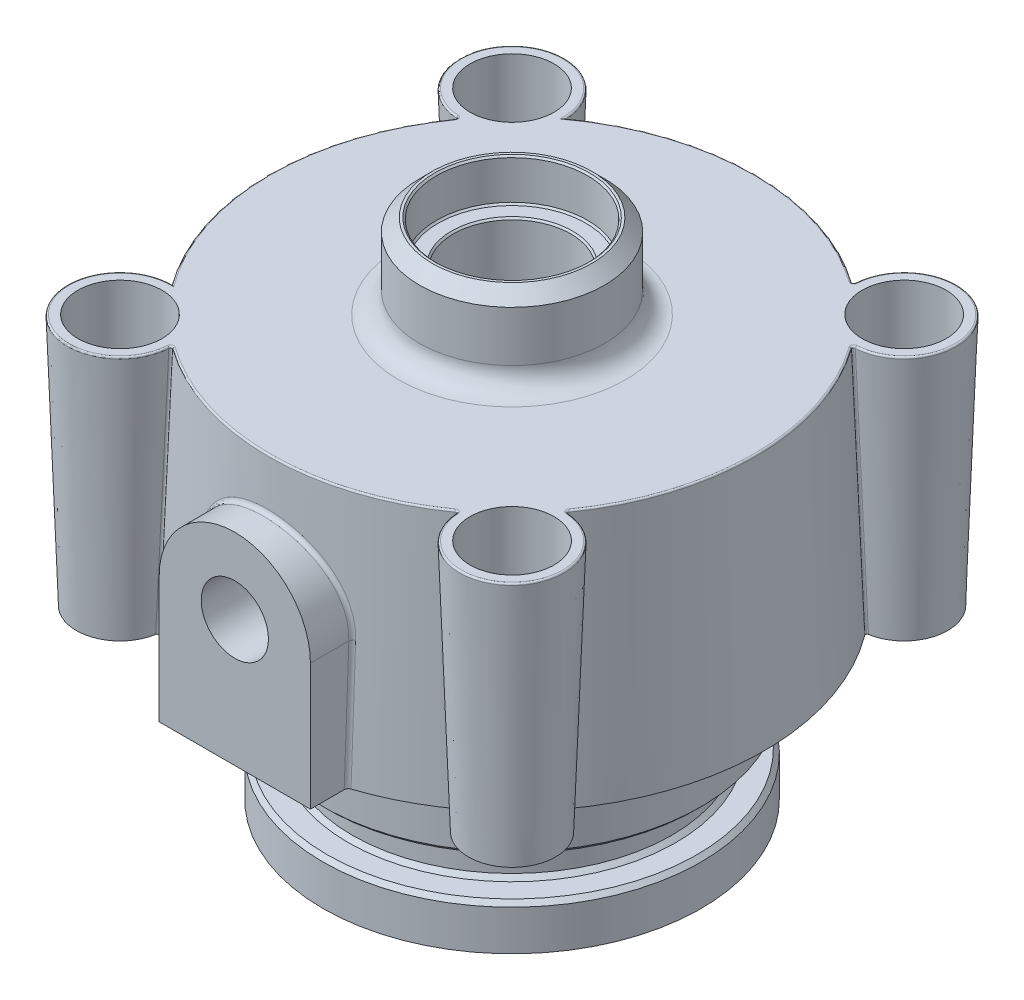
from build123d import *
from build123d.topology import SkipClean

# Parameters (mm, degrees)
SKETCH1_R                = 22.5
BOSS_EXTRUDE1_DEPTH      = 20
SKETCH2_R                = 30
BOSS_EXTRUDE2_DEPTH      = 30
BOSS_EXTRUDE2_TAPER      = 2
SKETCH3_R                = 11
BOSS_EXTRUDE3_DEPTH      = 10
CROQUIS1_R               = 7
CORTAR_EXTRUIR1_DEPTH    = 90
CROQUIS2_R               = 9
CORTAR_EXTRUIR2_DEPTH    = 5
CROQUIS3_R               = 6.234995269
SALIENTE_EXTRUIR1_DEPTH  = 30
SALIENTE_EXTRUIR1_DRAFT  = -2
MATRIZC1_COPY_1_SKETCH_R = 6.234995269
MATRIZC1_COPY_1_DEPTH    = 30
MATRIZC1_COPY_1_DRAFT    = -2
MATRIZC1_COPY_2_SKETCH_R = 6.234995269
MATRIZC1_COPY_2_DEPTH    = 30
MATRIZC1_COPY_2_DRAFT    = -2
MATRIZC1_COPY_3_SKETCH_R = 6.234995269
MATRIZC1_COPY_3_DEPTH    = 30
MATRIZC1_COPY_3_DRAFT    = -2
SKETCH8_R                = 4
SALIENTE_EXTRUIR2_DEPTH  = 10
MATRIZC2_COUNT           = 2
CROQUIS11_R              = 4
CORTAR_EXTRUIR5_DEPTH    = 40
CROQUIS12_W              = 3.5
CROQUIS12_H              = 4.7
CROQUIS13_W              = 11.998294714
CROQUIS13_H              = 4.103281459
SKETCH8_4_R              = 4
CORTAR_EXTRUIR7_DEPTH    = 7
CORTAR_EXTRUIR8_START    = -0.2
SKETCH8_5_R              = 4
CORTAR_EXTRUIR8_DEPTH    = 0.2
CROQUIS16_R              = 3
CORTAR_EXTRUIR9_DEPTH    = 34
CROQUIS17_R              = 3.5
CORTAR_EXTRUIR10_DEPTH   = 8
CORTAR_EXTRUIR11_START   = -0.2
CROQUIS17_2_R            = 3.5
CORTAR_EXTRUIR11_DEPTH   = 0.2
CROQUIS18_R              = 3
CORTAR_EXTRUIR12_DEPTH   = 8
CROQUIS19_R              = 2.5
CORTAR_EXTRUIR13_DEPTH   = 20
CROQUIS21_R              = 5
CROQUIS21_R_2            = 2.5
CORTAR_EXTRUIR14_DEPTH   = 10
MATRIZC3_COUNT           = 4
REDONDEO8_R              = 0.2
CHAFL_N1_SIZE            = 0.25
REDONDEO10_R             = 2.5
CROQUIS24_R              = 3
CORTAR_EXTRUIR16_DEPTH   = 30
CROQUIS25_R              = 3
CORTAR_EXTRUIR17_DEPTH   = 30
CHAFL_N2_SIZE            = 1.5
CHAFL_N3_SIZE            = 0.5
REDONDEO11_R             = 0.5
CHAFL_N4_SIZE            = 0.2
CHAFL_N5_SIZE            = 0.2
CHAFL_N6_SIZE            = 0.2
CHAFL_N7_SIZE            = 0.5
REDONDEO13_R             = 0.5
REDONDEO14_R             = 0.5


with BuildPart() as part:
    # Sketch1 → Boss-Extrude1 (new body)
    with BuildSketch(Plane(origin=(0, 0, 0), x_dir=(1, 0, 0), z_dir=(0, 1, 0))):
        with Locations(Location((0, 0, 0), (0, 0, 270))):
            Circle(SKETCH1_R)
    extrude(amount=BOSS_EXTRUDE1_DEPTH)

    # Sketch2 → Boss-Extrude2 (add)
    with BuildSketch(Plane(origin=(0, 20, 0), x_dir=(1, 0, 0), z_dir=(0, 1, 0))):
        Circle(SKETCH2_R)
    extrude(amount=BOSS_EXTRUDE2_DEPTH, taper=BOSS_EXTRUDE2_TAPER)

    # Sketch3 → Boss-Extrude3 (add)
    with BuildSketch(Plane(origin=(0, 50, 0), x_dir=(1, 0, 0), z_dir=(0, 1, 0))):
        with Locations(Location((0, 0, 0), (0, 0, 270))):
            Circle(SKETCH3_R)
    extrude(amount=BOSS_EXTRUDE3_DEPTH)

    # Croquis1 → Cortar-Extruir1 (cut)
    with BuildSketch(Plane(origin=(0, 60, 0), x_dir=(1, 0, 0), z_dir=(0, 1, 0))):
        with Locations(Location((0, 0, 0), (0, 0, 270))):
            Circle(CROQUIS1_R)
    extrude(amount=-CORTAR_EXTRUIR1_DEPTH, mode=Mode.SUBTRACT)

    # Croquis2 → Cortar-Extruir2 (cut)
    with BuildSketch(Plane(origin=(0, 60, 0), x_dir=(1, 0, 0), z_dir=(0, 1, 0))):
        with Locations(Location((0, 0, 0), (0, 0, 270))):
            Circle(CROQUIS2_R)
    extrude(amount=-CORTAR_EXTRUIR2_DEPTH, mode=Mode.SUBTRACT)


with BuildPart() as saliente_extruir1_tool:
    # Croquis3 → Saliente-Extruir1 (with draft: the straight prism first)
    with BuildSketch(Plane(origin=(0, 50, 0), x_dir=(1, 0, 0), z_dir=(0, 1, 0))):
        with Locations((-23.334523779, 23.334523779)):
            Circle(CROQUIS3_R)
    extrude(amount=-SALIENTE_EXTRUIR1_DEPTH)
    # Saliente-Extruir1: the draft: its side faces are tilted about the plane it starts from
    saliente_extruir1_sides = [saliente_extruir1_tool.faces().sort_by_distance(p)[0] for p in [
        (-29.569519048, 35, -23.334523779),
    ]]
    draft(saliente_extruir1_sides, Plane(origin=(0, 50, 0), x_dir=(1, 0, 0), z_dir=(0, 1, 0)), SALIENTE_EXTRUIR1_DRAFT)


with BuildPart() as part_1:
    add(part.part)

    # Saliente-Extruir1: add saliente_extruir1_tool
    add(saliente_extruir1_tool.part)


with BuildPart() as matrizc1_copy_1_tool:
    # MatrizC1 copy 1 sketch → MatrizC1 copy 1 (with draft: the straight prism first)
    with BuildSketch(Plane(origin=(0, 50, 0), x_dir=(0, 0, -1), z_dir=(0, 1, 0))):
        with Locations((-23.334523779, 23.334523779)):
            Circle(MATRIZC1_COPY_1_SKETCH_R)
    extrude(amount=-MATRIZC1_COPY_1_DEPTH)
    # MatrizC1 copy 1: the draft: its side faces are tilted about the plane it starts from
    matrizc1_copy_1_sides = [matrizc1_copy_1_tool.faces().sort_by_distance(p)[0] for p in [
        (-23.334523779, 35, 29.569519048),
    ]]
    draft(matrizc1_copy_1_sides, Plane(origin=(0, 50, 0), x_dir=(0, 0, -1), z_dir=(0, 1, 0)), MATRIZC1_COPY_1_DRAFT)


with BuildPart() as part_2:
    add(part_1.part)

    # MatrizC1 copy 1: add matrizc1_copy_1_tool
    add(matrizc1_copy_1_tool.part)


with BuildPart() as matrizc1_copy_2_tool:
    # MatrizC1 copy 2 sketch → MatrizC1 copy 2 (with draft: the straight prism first)
    with BuildSketch(Plane(origin=(0, 50, 0), x_dir=(-1, 0, 0), z_dir=(0, 1, 0))):
        with Locations((-23.334523779, 23.334523779)):
            Circle(MATRIZC1_COPY_2_SKETCH_R)
    extrude(amount=-MATRIZC1_COPY_2_DEPTH)
    # MatrizC1 copy 2: the draft: its side faces are tilted about the plane it starts from
    matrizc1_copy_2_sides = [matrizc1_copy_2_tool.faces().sort_by_distance(p)[0] for p in [
        (29.569519048, 35, 23.334523779),
    ]]
    draft(matrizc1_copy_2_sides, Plane(origin=(0, 50, 0), x_dir=(-1, 0, 0), z_dir=(0, 1, 0)), MATRIZC1_COPY_2_DRAFT)


with BuildPart() as part_3:
    add(part_2.part)

    # MatrizC1 copy 2: add matrizc1_copy_2_tool
    add(matrizc1_copy_2_tool.part)


with BuildPart() as matrizc1_copy_3_tool:
    # MatrizC1 copy 3 sketch → MatrizC1 copy 3 (with draft: the straight prism first)
    with BuildSketch(Plane.ZX.offset(50)):
        with Locations((-23.334523779, 23.334523779)):
            Circle(MATRIZC1_COPY_3_SKETCH_R)
    extrude(amount=-MATRIZC1_COPY_3_DEPTH)
    # MatrizC1 copy 3: the draft: its side faces are tilted about the plane it starts from
    matrizc1_copy_3_sides = [matrizc1_copy_3_tool.faces().sort_by_distance(p)[0] for p in [
        (23.334523779, 35, -29.569519048),
    ]]
    draft(matrizc1_copy_3_sides, Plane.ZX.offset(50), MATRIZC1_COPY_3_DRAFT)


with BuildPart() as part_4:
    add(part_3.part)

    # MatrizC1 copy 3: add matrizc1_copy_3_tool
    add(matrizc1_copy_3_tool.part)

    # Sketch8 → Saliente-Extruir2 (add)
    with BuildSketch(Plane.XY.offset(23)):
        with BuildLine():
            Line((-9, 20), (-9, 35.048848589))
            ThreePointArc((-9, 35.048848589), (0, 44.048848589), (9, 35.048848589))
            Line((9, 35.048848589), (9, 20))
            Line((9, 20), (-9, 20))
        make_face()
        with Locations(Location((0, 35.048848589, 0), (0, 0, 224.629878984))):
            Circle(SKETCH8_R, mode=Mode.SUBTRACT)
    saliente_extruir2 = extrude(amount=SALIENTE_EXTRUIR2_DEPTH)

    # MatrizC2: Saliente-Extruir2 ×2 about axis
    matrizc2_axis = Axis((0, 0, 0), (0, 1, 0))
    for i in range(1, MATRIZC2_COUNT):
        add(saliente_extruir2.rotate(matrizc2_axis, i * 360 / MATRIZC2_COUNT))

    # Croquis11 → Cortar-Extruir5 (cut)
    with SkipClean():  # the faces are left unmerged after this step: merging them gives an invalid solid
        with BuildSketch(Plane(origin=(0, 0, -37), x_dir=(-1, 0, 0), z_dir=(0, 0, -1))):
            with Locations(Location((0, 35.048848589, 0), (0, 0, 315.370121016))):
                Circle(CROQUIS11_R)
        extrude(amount=-CORTAR_EXTRUIR5_DEPTH, mode=Mode.SUBTRACT)
    add(part_4.part.scale(1), mode=Mode.REPLACE)  # the faces are merged on a copy

    # Croquis12 → Cortar-Revolución1 (revolve, cut)
    with BuildSketch(Plane(origin=(0, 0, 0), x_dir=(0, 0, -1), z_dir=(1, 0, 0)), mode=Mode.PRIVATE) as cortar_revoluci_n1_sk:
        with Locations((-20.75, 7.65)):
            Rectangle(CROQUIS12_W, CROQUIS12_H)
    revolve(cortar_revoluci_n1_sk.sketch.rotate(Axis((0, 0, 0), (0, 1, 0)), 180), axis=Axis((0, 0, 0), (0, 1, 0)), mode=Mode.SUBTRACT)

    # Croquis13 → Cortar-Revolución3 (revolve, cut)
    with BuildSketch(Plane(origin=(0, 0, 0), x_dir=(0, 0, -1), z_dir=(1, 0, 0))):
        with Locations((-5.999147357, 15.802504601)):
            Rectangle(CROQUIS13_W, CROQUIS13_H)
    revolve(axis=Axis((0, 17.85414533, -0.001705286), (0, -1, 0)), mode=Mode.SUBTRACT)

    # Sketch8<4> → Cortar-Extruir7 (cut)
    with BuildSketch(Plane.XY.offset(23)):
        with Locations((0, 35.048848589)):
            Circle(SKETCH8_4_R)
    extrude(amount=CORTAR_EXTRUIR7_DEPTH, mode=Mode.SUBTRACT)

    # Sketch8<5> → Cortar-Extruir8 (cut)
    with BuildSketch(Plane.XY.offset(23).offset(CORTAR_EXTRUIR8_START)):
        with Locations((0, 35.048848589)):
            Circle(SKETCH8_5_R)
    extrude(amount=CORTAR_EXTRUIR8_DEPTH, mode=Mode.SUBTRACT)

    # Croquis16 → Cortar-Extruir9 (cut)
    with BuildSketch(Plane.XZ):
        with Locations(Location((0, 14.310353932, 0), (0, 0, 270))):
            Circle(CROQUIS16_R)
    extrude(amount=-CORTAR_EXTRUIR9_DEPTH, mode=Mode.SUBTRACT)

    # Croquis17 → Cortar-Extruir10 (cut)
    with BuildSketch(Plane.XY.offset(15)):
        with Locations(Location((0, 35.048848589, 0), (0, 0, 213.468692257))):
            Circle(CROQUIS17_R)
    extrude(amount=CORTAR_EXTRUIR10_DEPTH, mode=Mode.SUBTRACT)

    # Croquis17<2> → Cortar-Extruir11 (cut)
    with BuildSketch(Plane.XY.offset(15).offset(CORTAR_EXTRUIR11_START)):
        with Locations(Location((0, 35.048848589, 0), (0, 0, 212.258465463))):
            Circle(CROQUIS17_2_R)
    extrude(amount=CORTAR_EXTRUIR11_DEPTH, mode=Mode.SUBTRACT)

    # Croquis18 → Cortar-Extruir12 (cut)
    with BuildSketch(Plane.XY.offset(13)):
        with Locations((0, 35.048848589)):
            Circle(CROQUIS18_R)
    extrude(amount=CORTAR_EXTRUIR12_DEPTH, mode=Mode.SUBTRACT)

    # Croquis19 → Cortar-Extruir13 (cut)
    with BuildSketch(Plane.XY):
        with Locations(Location((0, 35.048848589, 0), (0, 0, 269.999999999))):
            Circle(CROQUIS19_R)
    extrude(amount=CORTAR_EXTRUIR13_DEPTH, mode=Mode.SUBTRACT)

    # Croquis21 → Cortar-Extruir14 (cut)
    # profile 1 of 2: a face of its own
    with BuildSketch(Plane(origin=(0, 50, 0), x_dir=(1, 0, 0), z_dir=(0, 1, 0))):
        with Locations(Location((-23.334523779, 23.334523779, 0), (0, 0, 270))):
            Circle(CROQUIS21_R)
        with Locations((-23.334523779, 23.334523779)):
            Circle(CROQUIS21_R_2, mode=Mode.SUBTRACT)
    # profile 2 of 2: a face of its own
    with BuildSketch(Plane(origin=(0, 50, 0), x_dir=(1, 0, 0), z_dir=(0, 1, 0))):
        with Locations((-23.334523779, 23.334523779)):
            Circle(CROQUIS21_R_2)
    cortar_extruir14 = extrude(amount=-CORTAR_EXTRUIR14_DEPTH, mode=Mode.SUBTRACT)

    # MatrizC3: Cortar-Extruir14 ×4 about axis
    matrizc3_axis = Axis((0, 0, 0), (0, 1, 0))
    for i in range(1, MATRIZC3_COUNT):
        add(cortar_extruir14.rotate(matrizc3_axis, i * 360 / MATRIZC3_COUNT), mode=Mode.SUBTRACT)

    # Redondeo8
    redondeo8_edges = [part_4.edges().sort_by_distance(p)[0] for p in [
        (-23.628212149, 34.642434193, -17.643399327),
        (-17.643399327, 34.642434193, 23.628212149),
        (23.628212149, 34.642434193, 17.643399327),
        (17.643399327, 34.642434193, 23.628212149),
        (17.643399327, 34.642434193, -23.628212149),
        (23.628212149, 34.642434193, -17.643399327),
    ]]
    fillet(redondeo8_edges, radius=REDONDEO8_R)
    redondeo8_2_edges = [part_4.edges().sort_by_distance(p)[0] for p in [
        (-28.951772779, 50, 0.18703477),
        (-27.610766074, 50, -27.872025056),
        (0, 50, 28.952376915),
        (28.952376915, 50, 0),
        (-0.18703477, 50, -28.951772779),
        (-27.872025056, 50, 27.610766074),
        (27.743331214, 50, 27.743331214),
        (27.743331214, 50, -27.743331214),
        (23.564597097, 50, -16.99843862),
        (16.99843862, 50, -23.564597097),
        (16.99843862, 50, 23.564597097),
        (23.564597097, 50, 16.99843862),
        (-16.99843862, 50, 23.564597097),
        (-23.564597097, 50, -16.99843862),
    ]]
    fillet(redondeo8_2_edges, radius=REDONDEO8_R)

    # Chaflán1
    # the kernel refuses this chamfer: 0.25 mm, written as the material it takes off along each edge
    with BuildSketch(Plane(origin=(0, 35.048848589, 14.8), x_dir=(-0.8408763674945526, -0.5412272485649315, 0), z_dir=(0.5412272485649315, -0.8408763674945526, 0))) as chafl_n1_piece_1:
        Polygon((3 + CHAFL_N1_SIZE, 0), (3, CHAFL_N1_SIZE), (3, 0), align=None)
    revolve(axis=Axis((0, 35.048848589, 14.8), (0, 0, -1)), revolution_arc=212.767222111, mode=Mode.SUBTRACT)
    with BuildSketch(Plane(origin=(0, 35.048848589, 14.8), x_dir=(1, 0, 0), z_dir=(0, 1, 0))) as chafl_n1_piece_2:
        Polygon((3 + CHAFL_N1_SIZE, 0), (3, CHAFL_N1_SIZE), (3, 0), align=None)
    revolve(axis=Axis((0, 35.048848589, 14.8), (0, 0, -1)), revolution_arc=32.742978498, mode=Mode.SUBTRACT)

    # Redondeo10
    redondeo10_edges = [part_4.edges().sort_by_distance(p)[0] for p in [
        (0, 50, -11),
    ]]
    fillet(redondeo10_edges, radius=REDONDEO10_R)

    # Croquis24 → Cortar-Extruir16 (cut)
    with BuildSketch(Plane(origin=(0, 50, 0), x_dir=(1, 0, 0), z_dir=(0, 1, 0))):
        with Locations(Location((-23.334523779, 23.334523779, 0), (0, 0, 270))):
            Circle(CROQUIS24_R)
    extrude(amount=-CORTAR_EXTRUIR16_DEPTH, mode=Mode.SUBTRACT)

    # Croquis25 → Cortar-Extruir17 (cut)
    with BuildSketch(Plane(origin=(0, 50, 0), x_dir=(1, 0, 0), z_dir=(0, 1, 0))):
        with Locations(Location((-23.334523779, -23.334523779, 0), (0, 0, 270))):
            Circle(CROQUIS25_R)
        with Locations(Location((23.334523779, -23.334523779, 0), (0, 0, 270))):
            Circle(CROQUIS25_R)
        with Locations(Location((23.334523779, 23.334523779, 0), (0, 0, 270))):
            Circle(CROQUIS25_R)
    extrude(amount=-CORTAR_EXTRUIR17_DEPTH, mode=Mode.SUBTRACT)

    # Chaflán2
    chafl_n2_edges = [part_4.edges().sort_by_distance(p)[0] for p in [
        (0, 60, -11),
    ]]
    chamfer(chafl_n2_edges, length=CHAFL_N2_SIZE)

    # Chaflán3
    chafl_n3_edges = [part_4.edges().sort_by_distance(p)[0] for p in [
        (0, 10, -22.5),
        (0, 10, 19),
        (0, 5.3, 19),
        (0, 5.3, -22.5),
    ]]
    chamfer(chafl_n3_edges, length=CHAFL_N3_SIZE)

    # Redondeo11
    redondeo11_edges = [part_4.edges().sort_by_distance(p)[0] for p in [
        (0, 20, -22.5),
    ]]
    fillet(redondeo11_edges, radius=REDONDEO11_R)

    # Chaflán4
    chafl_n4_edges = [part_4.edges().sort_by_distance(p)[0] for p in [
        (0, 55, -9),
        (0, 55, -7),
    ]]
    chamfer(chafl_n4_edges, length=CHAFL_N4_SIZE)

    # Chaflán5
    chafl_n5_edges = [part_4.edges().sort_by_distance(p)[0] for p in [
        (0, 17.85414533, -12.001705286),
        (0, 13.750863871, -7),
        (0, 17.85414533, -7),
        (0, 13.750863871, -12.001705286),
    ]]
    chamfer(chafl_n5_edges, length=CHAFL_N5_SIZE)

    # Chaflán6
    chafl_n6_edges = [part_4.edges().sort_by_distance(p)[0] for p in [
        (0, 60, -9),
    ]]
    chamfer(chafl_n6_edges, length=CHAFL_N6_SIZE)

    # Chaflán7
    chafl_n7_edges = [part_4.edges().sort_by_distance(p)[0] for p in [
        (0, 39.048848589, -33),
    ]]
    chamfer(chafl_n7_edges, length=CHAFL_N7_SIZE)

    # Redondeo13
    redondeo13_edges = [part_4.edges().sort_by_distance(p)[0] for p in [
        (0, 44.048848588, 29.160195702),
        (9, 27.524428789, 28.342609471),
        (-9, 27.524428789, 28.342609471),
    ]]
    fillet(redondeo13_edges, radius=REDONDEO13_R)

    # Redondeo14
    redondeo14_edges = [part_4.edges().sort_by_distance(p)[0] for p in [
        (0, 44.048848588, -29.160195702),
        (-9, 27.524428789, -28.342609471),
        (9, 27.524428789, -28.342609471),
    ]]
    fillet(redondeo14_edges, radius=REDONDEO14_R)


solid = part_4.part
